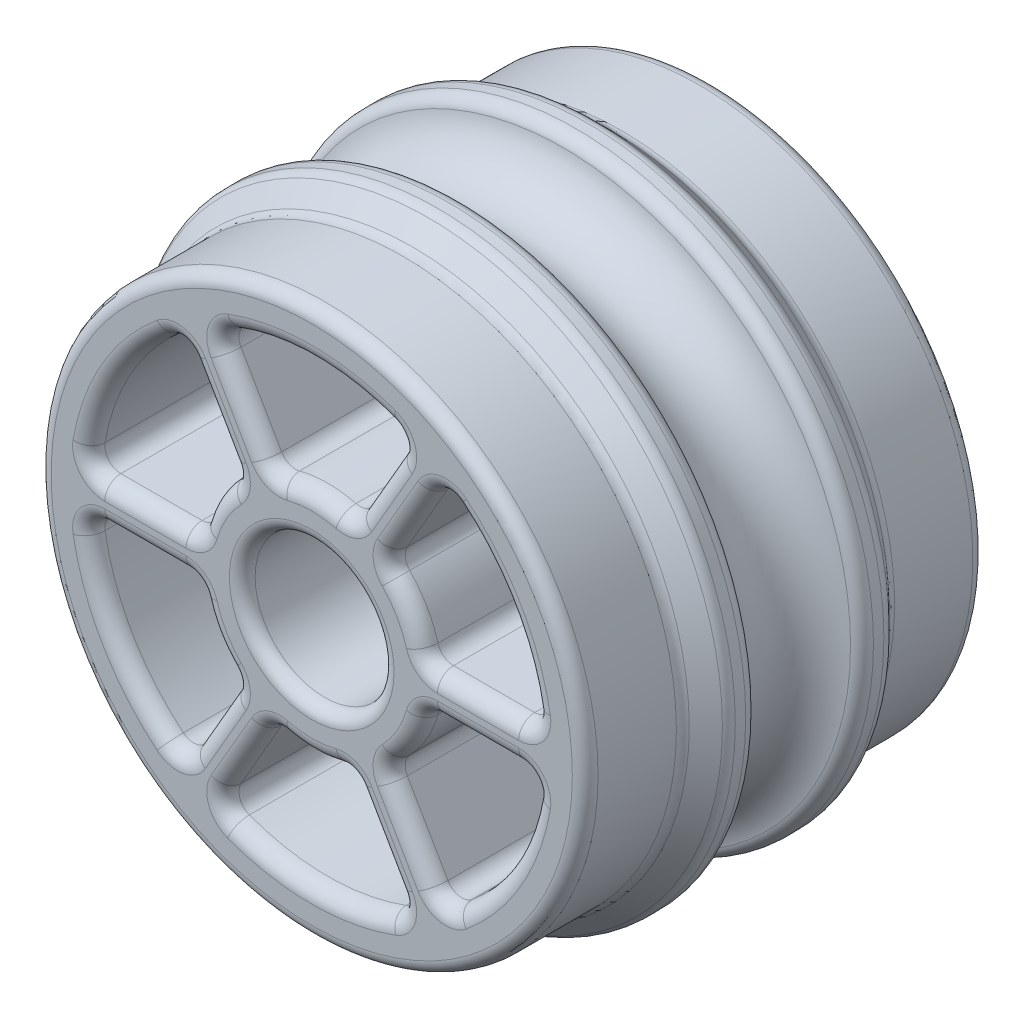
from build123d import *

# Parameters (mm, degrees)
CHAMFER1_SIZE      = 2
CUT_EXTRUDE1_DEPTH = 37.118001052
CIRPATTERN1_COUNT  = 6
FILLET1_R          = 1
FILLET2_R          = 0.8
FILLET3_R          = 0.8
FILLET4_R          = 0.8


with BuildPart() as part:
    # Sketch1 → Revolve1 (revolve)
    with BuildSketch(Plane(origin=(0, 0, 0), x_dir=(0, 0, -1), z_dir=(1, 0, 0)), mode=Mode.PRIVATE) as revolve1_sk:
        with BuildLine():
            Line((-12.45, 4.318), (12.45, 4.318))
            Line((12.45, 4.318), (12.45, 17))
            Line((12.45, 17), (4.45, 17))
            Line((4.45, 17), (4.45, 18.5))
            Line((4.45, 18.5), (3.25, 18.5))
            ThreePointArc((3.25, 18.5), (0, 15.25), (-3.25, 18.5))
            Line((-3.25, 18.5), (-4.45, 18.5))
            Line((-4.45, 18.5), (-4.45, 17))
            Line((-4.45, 17), (-12.45, 17))
            Line((-12.45, 17), (-12.45, 4.318))
        make_face()
    revolve(revolve1_sk.sketch.rotate(Axis((0, 0, 0), (0, 0, 1)), 90), axis=Axis((0, 0, 0), (0, 0, 1)))

    # Chamfer1
    # the kernel refuses this chamfer: 2 mm, written as the material it adds along each edge
    with BuildSketch(Plane(origin=(0, 0, -4.45), x_dir=(-1, 0, 0), z_dir=(0, 1, 0))) as chamfer1_piece_1_section:
        Polygon((17, -CHAMFER1_SIZE), (17 + CHAMFER1_SIZE, 0), (17, 0), align=None)
    chamfer1_piece_1 = revolve(axis=Axis((0, 0, -4.45), (0, 0, 1)), mode=Mode.PRIVATE)
    chamfer1_piece_1 = chamfer1_piece_1 & Plane(origin=(0, 0, -5.685294558), x_dir=(-1, 0, 0), z_dir=(0, 0, 1)) * Cylinder(18.5, 76, mode=Mode.PRIVATE)
    add(chamfer1_piece_1)
    with BuildSketch(Plane(origin=(0, 0, 4.45), x_dir=(-1, 0, 0), z_dir=(0, 1, 0))) as chamfer1_piece_2_section:
        Polygon((17 + CHAMFER1_SIZE, 0), (17, CHAMFER1_SIZE), (17, 0), align=None)
    chamfer1_piece_2 = revolve(axis=Axis((0, 0, 4.45), (0, 0, 1)), mode=Mode.PRIVATE)
    chamfer1_piece_2 = chamfer1_piece_2 & Plane(origin=(0, 0, 5.685294558), x_dir=(-1, 0, 0), z_dir=(0, 0, 1)) * Cylinder(18.5, 76, mode=Mode.PRIVATE)
    add(chamfer1_piece_2)

    # Sketch2 → Cut-Extrude1 (cut, through all)
    with BuildSketch(Plane.XY.offset(12.45)):
        with BuildLine():
            Line((-2.468828951, 6.676137178), (-5.960099841, 12.723195742))
            ThreePointArc((-5.960099841, 12.723195742), (0, 14.05), (5.960099841, 12.723195742))
            Line((5.960099841, 12.723195742), (2.468828951, 6.676137178))
            ThreePointArc((2.468828951, 6.676137178), (0, 7.118), (-2.468828951, 6.676137178))
        make_face()
    cut_extrude1 = extrude(amount=-CUT_EXTRUDE1_DEPTH, mode=Mode.SUBTRACT)

    # CirPattern1: Cut-Extrude1 ×6 about axis
    cirpattern1_axis = Axis((0, 0, 0), (0, 0, 1))
    for i in range(1, CIRPATTERN1_COUNT):
        add(cut_extrude1.rotate(cirpattern1_axis, i * 360 / CIRPATTERN1_COUNT), mode=Mode.SUBTRACT)

    # Fillet1
    fillet1_edges = [part.edges().sort_by_distance(p)[0] for p in [
        (0, 14.05, -12.45),
        (-5.960099841, 12.723195742, 0),
        (4.214464396, 9.69966646, -12.45),
        (5.960099841, 12.723195742, 0),
        (0, 7.118, -12.45),
        (2.468828951, 6.676137178, 0),
        (-4.214464396, 9.69966646, -12.45),
        (-2.468828951, 6.676137178, 0),
        (0, 14.05, 12.45),
        (-4.214464396, 9.69966646, 12.45),
        (0, 7.118, 12.45),
        (4.214464396, 9.69966646, 12.45),
        (12.167656923, 7.025, -12.45),
        (8.03856081, 11.523195742, 0),
        (10.50738976, 1.2, -12.45),
        (13.99866065, 1.2, 0),
        (6.164368824, 3.559, -12.45),
        (7.01611887, 1.2, 0),
        (6.292925365, 8.49966646, -12.45),
        (4.54728992, 5.476137178, 0),
        (12.167656923, 7.025, 12.45),
        (6.292925365, 8.49966646, 12.45),
        (6.164368824, 3.559, 12.45),
        (10.50738976, 1.2, 12.45),
        (-12.167656923, 7.025, -12.45),
        (-13.99866065, 1.2, 0),
        (-6.292925365, 8.49966646, -12.45),
        (-8.03856081, 11.523195742, 0),
        (-6.164368824, 3.559, -12.45),
        (-4.54728992, 5.476137178, 0),
        (-10.50738976, 1.2, -12.45),
        (-7.01611887, 1.2, 0),
        (-12.167656923, 7.025, 12.45),
        (-10.50738976, 1.2, 12.45),
        (-6.164368824, 3.559, 12.45),
        (-6.292925365, 8.49966646, 12.45),
        (-12.167656923, -7.025, -12.45),
        (-8.03856081, -11.523195742, 0),
        (-10.50738976, -1.2, -12.45),
        (-13.99866065, -1.2, 0),
        (-6.164368824, -3.559, -12.45),
        (-7.01611887, -1.2, 0),
        (-6.292925365, -8.49966646, -12.45),
        (-4.54728992, -5.476137178, 0),
        (-12.167656923, -7.025, 12.45),
        (-6.292925365, -8.49966646, 12.45),
        (-6.164368824, -3.559, 12.45),
        (-10.50738976, -1.2, 12.45),
        (12.167656923, -7.025, -12.45),
        (13.99866065, -1.2, 0),
        (6.292925365, -8.49966646, -12.45),
        (8.03856081, -11.523195742, 0),
        (6.164368824, -3.559, -12.45),
        (4.54728992, -5.476137178, 0),
        (10.50738976, -1.2, -12.45),
        (7.01611887, -1.2, 0),
        (12.167656923, -7.025, 12.45),
        (10.50738976, -1.2, 12.45),
        (6.164368824, -3.559, 12.45),
        (6.292925365, -8.49966646, 12.45),
        (0, -14.05, -12.45),
        (5.960099841, -12.723195742, 0),
        (-4.214464396, -9.69966646, -12.45),
        (-5.960099841, -12.723195742, 0),
        (0, -7.118, -12.45),
        (-2.468828951, -6.676137178, 0),
        (4.214464396, -9.69966646, -12.45),
        (2.468828951, -6.676137178, 0),
        (0, -14.05, 12.45),
        (4.214464396, -9.69966646, 12.45),
        (0, -7.118, 12.45),
        (-4.214464396, -9.69966646, 12.45),
    ]]
    fillet(fillet1_edges, radius=FILLET1_R)

    # Fillet2
    fillet2_edges = [part.edges().sort_by_distance(p)[0] for p in [
        (17, 0, -6.45),
        (17, 0, 6.45),
        (18.5, 0, -4.95),
        (18.5, 0, 4.95),
        (18.5, 0, -3.25),
        (18.5, 0, 3.25),
    ]]
    fillet(fillet2_edges, radius=FILLET2_R)

    # Fillet3
    fillet3_edges = [part.edges().sort_by_distance(p)[0] for p in [
        (4.318, 0, 12.45),
        (4.318, 0, -12.45),
    ]]
    fillet(fillet3_edges, radius=FILLET3_R)

    # Fillet4
    fillet4_edges = [part.edges().sort_by_distance(p)[0] for p in [
        (17, 0, 12.45),
        (17, 0, -12.45),
    ]]
    fillet(fillet4_edges, radius=FILLET4_R)


solid = part.part
